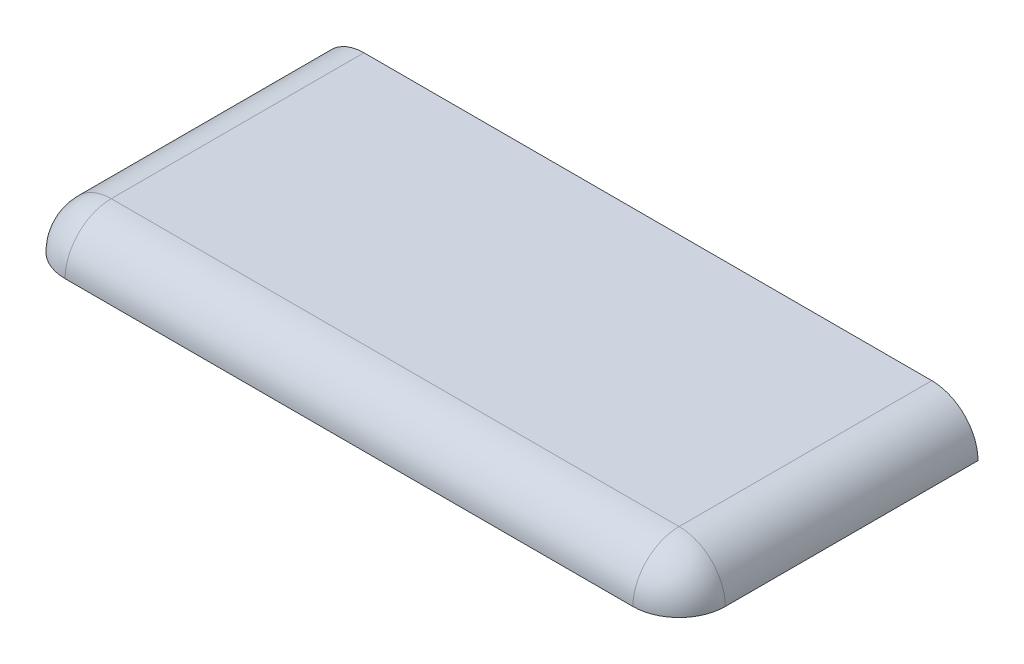
from build123d import *

# Parameters (mm, degrees)
SKETCH1_W           = 36.310674736
SKETCH1_H           = 16.43794059
BOSS_EXTRUDE1_DEPTH = 2.54
FILLET1_R           = 2.54
FILLET2_R           = 2.54


# Some blends are built 0.0001 mm under size
with BuildPart() as part:
    # Sketch1 → Boss-Extrude1 (new body)
    with BuildSketch(Plane(origin=(0, 0, 0), x_dir=(1, 0, 0), z_dir=(0, 1, 0))):
        Rectangle(SKETCH1_W, SKETCH1_H)
    extrude(amount=BOSS_EXTRUDE1_DEPTH)

    # Fillet1
    fillet1_edges = [part.edges().sort_by_distance(p)[0] for p in [
        (18.155337368, 1.27, 8.218970295),
        (-18.155337368, 1.27, 8.218970295),
        (0, 2.54, 8.218970295),
    ]]
    fillet(fillet1_edges, radius=FILLET1_R - 0.0001)  # a hair under: the kernel refuses the full size

    # Fillet2
    # the kernel refuses this fillet: 2.54 mm, written as the material it takes off along each edge
    with BuildSketch(Plane(origin=(-15.615337368, 0, 8.218970295), x_dir=(0, 1, 0), z_dir=(1, 0, 0))) as fillet2_piece_1:
        with BuildLine():
            CenterArc((0.0001, -2.5399), 2.5399, 0, 90)
            Line((2.54, -2.5399), (2.54, 0))
            Line((2.54, 0), (0.0001, 0))
        make_face()
    revolve(axis=Axis((-15.615337368, 0, 8.218970295), (0, 0, 1)), revolution_arc=90, mode=Mode.SUBTRACT)
    with BuildSketch(Plane(origin=(15.615337368, 0, 8.218970295), x_dir=(1, 0, 0), z_dir=(0, -1, 0))) as fillet2_piece_2:
        with BuildLine():
            CenterArc((0.0001, -2.5399), 2.5399, 0, 90)
            Line((2.54, -2.5399), (2.54, 0))
            Line((2.54, 0), (0.0001, 0))
        make_face()
    revolve(axis=Axis((15.615337368, 0, 8.218970295), (0, 0, 1)), revolution_arc=90, mode=Mode.SUBTRACT)
    with BuildSketch(Plane(origin=(-18.155337368, 2.54, 8.218970295), x_dir=(0, -1, 0), z_dir=(0, 0, -1)), Plane(origin=(18.155337368, 2.54, -14.568970295), x_dir=(0, -1, 0), z_dir=(0, 0, 1))) as fillet2_piece_3:
        with BuildLine():
            CenterArc((FILLET2_R, -FILLET2_R), FILLET2_R, 90, 90)
            Line((0, -FILLET2_R), (0, 0))
            Line((0, 0), (FILLET2_R, 0))
        make_face()
    extrude(amount=22.78794059, mode=Mode.SUBTRACT)


solid = part.part
